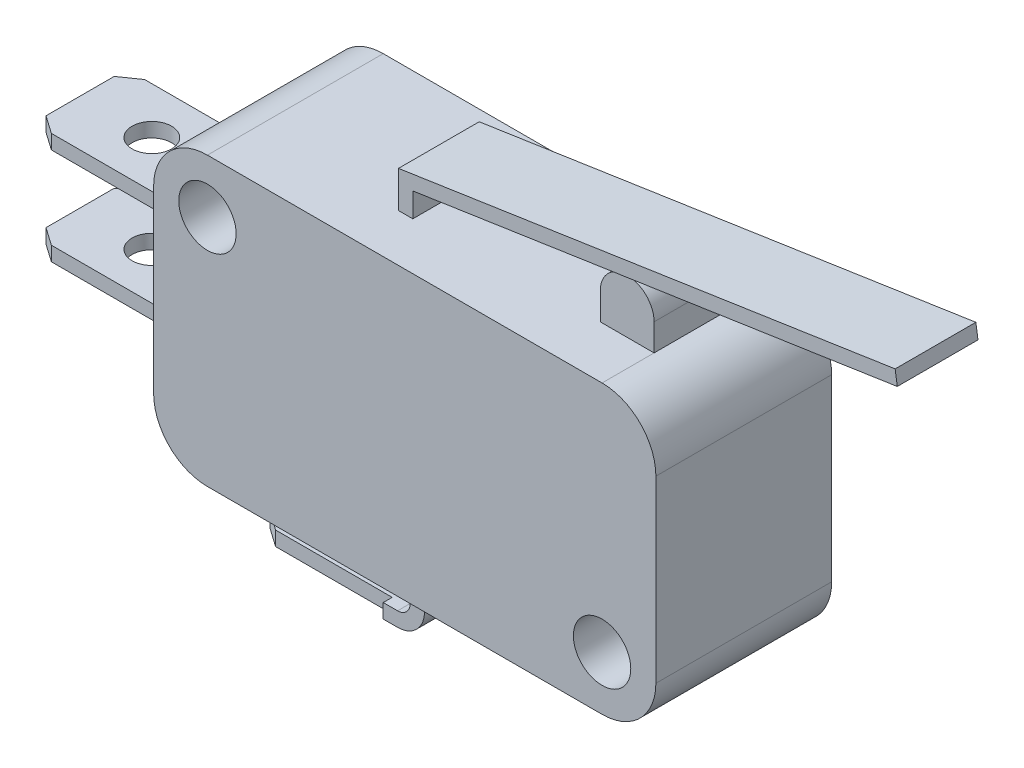
from build123d import *

# Parameters (mm, degrees)
SKETCH_1_W          = 28
SKETCH_1_H          = 16
EXTRUDE_1_DEPTH     = 4.9
EXTRUDE_2_DEPTH     = 2
SKETCH_3_W          = 6.2
SKETCH_3_H          = 0.8
EXTRUDE_3_DEPTH     = 9
SKETCH_4_R          = 1.1
CUT_EXTRUDE_1_DEPTH = 26.713226169
EXTRUDE_4_DEPTH     = 3.1
CUT_EXTRUDE_2_REACH = 34.408
SKETCH_6_R          = 1.1
EXTRUDE_10_DEPTH    = 2.25
FILLET_1_R          = 3
SKETCH_8_R          = 1.6
CUT_EXTRUDE_3_DEPTH = 31.217464609


with BuildPart() as part:
    # 草图1 → 凸台-拉伸1 (new, symmetric)
    with BuildSketch(Plane.XY):
        Rectangle(SKETCH_1_W, SKETCH_1_H)
    extrude(amount=EXTRUDE_1_DEPTH, both=True)

    # 草图2 → 凸台-拉伸2 (add, symmetric)
    with BuildSketch(Plane.XY):
        with BuildLine():
            Line((8, 8), (11, 8))
            Line((11, 8), (11, 9.5))
            ThreePointArc((11, 9.5), (9.5, 11), (8, 9.5))
            Line((8, 9.5), (8, 8))
        make_face()
    extrude(amount=EXTRUDE_2_DEPTH, both=True)

    # 草图3 → 凸台-拉伸3 (add)
    with BuildSketch(Plane.ZY.offset(14)):
        with Locations((0, 2)):
            Rectangle(SKETCH_3_W, SKETCH_3_H)
        with Locations((0, -3.4)):
            Rectangle(SKETCH_3_W, SKETCH_3_H)
    extrude(amount=EXTRUDE_3_DEPTH)

    # 草图4 → 切除-拉伸1 (cut, through all)
    with BuildSketch(Plane(origin=(0, 2.4, 0), x_dir=(1, 0, 0), z_dir=(0, 1, 0))):
        with Locations(Location((-19, 0, 0), (0, 0, 270))):
            Circle(SKETCH_4_R)
        Polygon((-15.5, 3.1), (-15.5, 2.6), (-22, 2.6), (-23, 1.9), (-23, 3.1), align=None)
        Polygon((-23, -3.1), (-15.5, -3.1), (-15.5, -2.6), (-22, -2.6), (-23, -1.9), align=None)
    extrude(amount=-CUT_EXTRUDE_1_DEPTH, mode=Mode.SUBTRACT)

    # 草图5 → 凸台-拉伸4 (add, symmetric)
    with BuildSketch(Plane.XY):
        with BuildLine():
            Line((-1.5, -8), (-0.7, -8))
            Line((-0.7, -8), (-0.7, -9.8))
            ThreePointArc((-0.7, -9.8), (-1.139339828, -10.860660172), (-2.2, -11.3))
            Line((-2.2, -11.3), (-10.5, -11.3))
            Line((-10.5, -11.3), (-10.5, -10.5))
            Line((-10.5, -10.5), (-2.2, -10.5))
            ThreePointArc((-2.2, -10.5), (-1.705025253, -10.294974747), (-1.5, -9.8))
            Line((-1.5, -9.8), (-1.5, -8))
        make_face()
    extrude(amount=EXTRUDE_4_DEPTH, both=True)

    # 草图6 → 切除-拉伸2 (cut, up to next)
    with BuildSketch(Plane.XZ.offset(11.3), mode=Mode.PRIVATE) as cut_extrude_2_sk1:
        with Locations((-6.5, 0)):
            Circle(SKETCH_6_R)
    cut_extrude_2_tool1 = extrude(cut_extrude_2_sk1.sketch, amount=-CUT_EXTRUDE_2_REACH, mode=Mode.PRIVATE) & part.part
    # 草图6 → 切除-拉伸2 (cut, up to next)
    with BuildSketch(Plane.XZ.offset(11.3), mode=Mode.PRIVATE) as cut_extrude_2_sk2:
        Polygon((-3, 3.1), (-3, 2.6), (-9.5, 2.6), (-10.5, 1.9), (-10.5, 3.1), align=None)
    cut_extrude_2_tool2 = extrude(cut_extrude_2_sk2.sketch, amount=-CUT_EXTRUDE_2_REACH, mode=Mode.PRIVATE) & part.part
    # 草图6 → 切除-拉伸2 (cut, up to next)
    with BuildSketch(Plane.XZ.offset(11.3), mode=Mode.PRIVATE) as cut_extrude_2_sk3:
        Polygon((-10.5, -3.1), (-3, -3.1), (-3, -2.6), (-9.5, -2.6), (-10.5, -1.9), align=None)
    cut_extrude_2_tool3 = extrude(cut_extrude_2_sk3.sketch, amount=-CUT_EXTRUDE_2_REACH, mode=Mode.PRIVATE) & part.part
    add(cut_extrude_2_tool1.solids().sort_by_distance((-6.5, -11.3, 0))[0], mode=Mode.SUBTRACT)
    add(cut_extrude_2_tool2.solids().sort_by_distance((-7.041667, -11.3, 2.80874))[0], mode=Mode.SUBTRACT)
    add(cut_extrude_2_tool3.solids().sort_by_distance((-7.041667, -11.3, -2.80874))[0], mode=Mode.SUBTRACT)

    # 草图7 → 凸台-拉伸10 (add, symmetric)
    with BuildSketch(Plane.XY):
        Polygon((-3, 8), (-2.2, 8), (-2.2, 9.346877402), (24.807562706, 13.408897757), (24.6885785, 14.2), (-3, 10.035552778), align=None)
    extrude(amount=EXTRUDE_10_DEPTH, both=True)

    # 圆角1
    fillet_1_edges = [part.edges().sort_by_distance(p)[0] for p in [
        (14, -8, 0),
        (-14, -8, 0),
        (-14, 8, 0),
        (14, 8, 0),
    ]]
    fillet(fillet_1_edges, radius=FILLET_1_R - 0.0001)  # a hair under: the kernel refuses the full size

    # 草图8 → 切除-拉伸3 (cut, through all)
    with BuildSketch(Plane.XY.offset(4.9)):
        with Locations((-11, 5)):
            Circle(SKETCH_8_R)
        with Locations((11, -5)):
            Circle(SKETCH_8_R)
    extrude(amount=-CUT_EXTRUDE_3_DEPTH, mode=Mode.SUBTRACT)


solid = part.part
